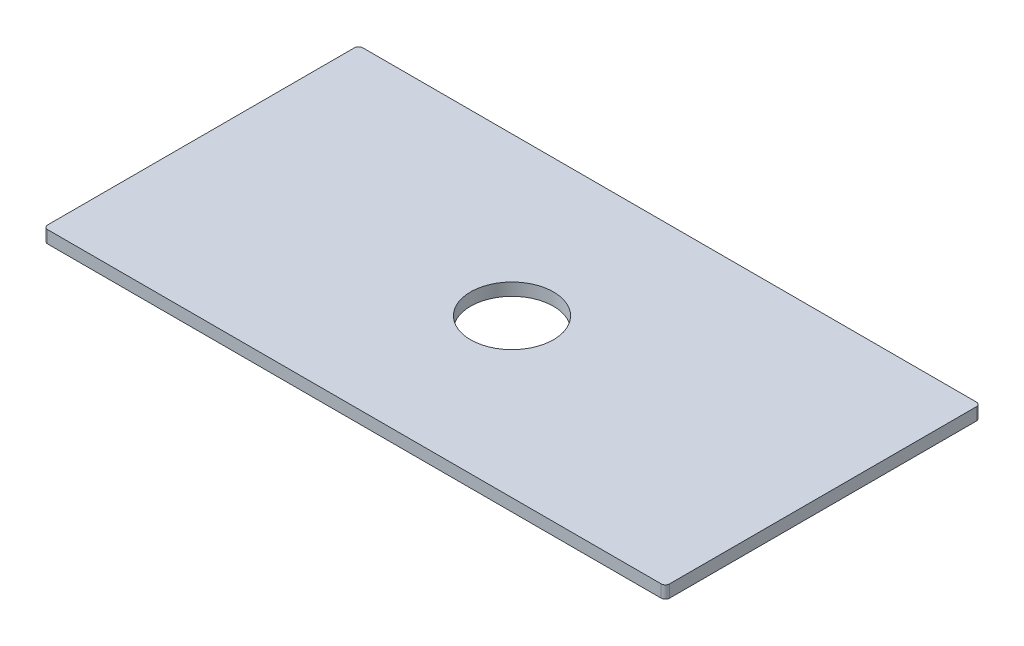
from build123d import *

# Parameters (mm, degrees)
SKETCH1_W           = 150
SKETCH1_H           = 76
BOSS_EXTRUDE1_DEPTH = 3
FILLET1_R           = 1
SKETCH2_R           = 10
CUT_EXTRUDE1_DEPTH  = 85.130850465


with BuildPart() as part:
    # Sketch1 → Boss-Extrude1 (new body)
    with BuildSketch(Plane(origin=(0, 0, 0), x_dir=(1, 0, 0), z_dir=(0, 1, 0))):
        Rectangle(SKETCH1_W, SKETCH1_H)
    extrude(amount=BOSS_EXTRUDE1_DEPTH)

    # Fillet1
    fillet1_edges = [part.edges().sort_by_distance(p)[0] for p in [
        (-75, 1.5, -38),
        (75, 1.5, -38),
        (75, 1.5, 38),
        (-75, 1.5, 38),
    ]]
    fillet(fillet1_edges, radius=FILLET1_R)

    # Sketch2 → Cut-Extrude1 (cut, through all)
    with BuildSketch(Plane(origin=(0, 3, 0), x_dir=(1, 0, 0), z_dir=(0, 1, 0))):
        Circle(SKETCH2_R)
    extrude(amount=-CUT_EXTRUDE1_DEPTH, mode=Mode.SUBTRACT)


solid = part.part
